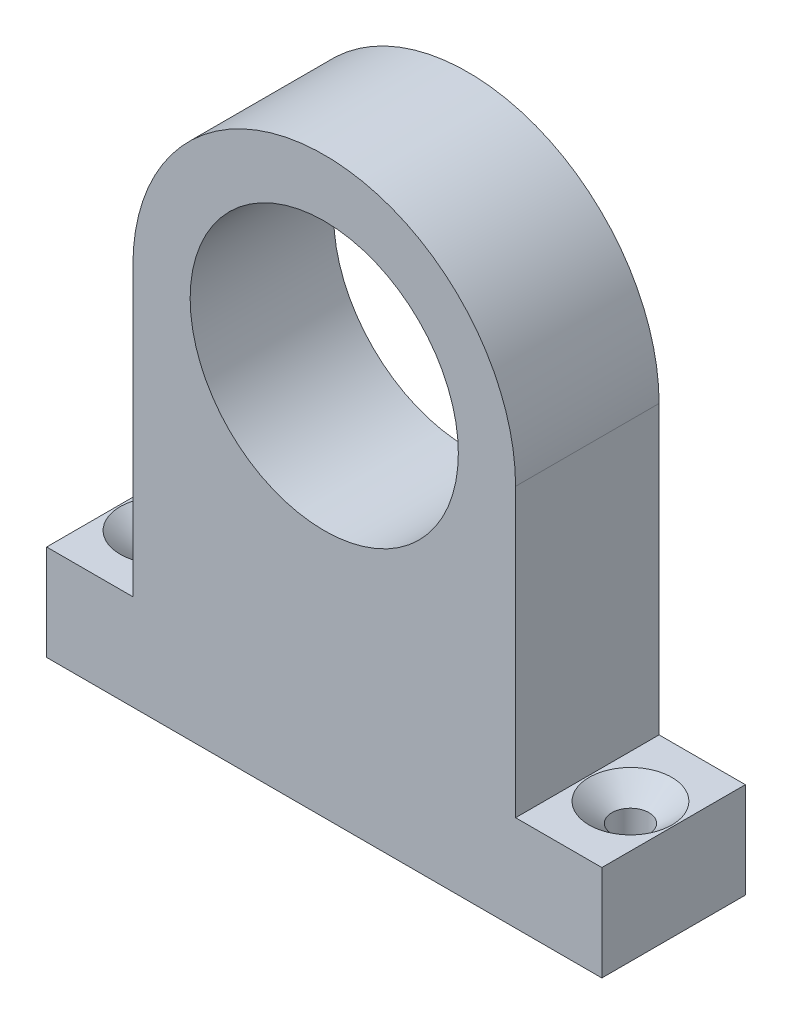
from build123d import *

# Parameters (mm, degrees)
SKETCH1_W                                         = 73.7
SKETCH1_H                                         = 19.05
BOSS_EXTRUDE2_DEPTH                               = 76.2
SKETCH2_R                                         = 17.8
CUT_EXTRUDE1_DEPTH                                = 104.891229177
CSK_FOR_8_FLAT_HEAD_MACHINE_SCREW_100_D           = 4.9149
CSK_FOR_8_FLAT_HEAD_MACHINE_SCREW_100_CSINK_D     = 10.9728
CSK_FOR_8_FLAT_HEAD_MACHINE_SCREW_100_CSINK_ANGLE = 100


with BuildPart() as part:
    # Sketch1 → Boss-Extrude2 (new body)
    with BuildSketch(Plane(origin=(0, 19.05, 0), x_dir=(1, 0, 0), z_dir=(0, 1, 0))):
        with Locations((0, -87.9856)):
            Rectangle(SKETCH1_W, SKETCH1_H)
    extrude(amount=BOSS_EXTRUDE2_DEPTH)

    # Sketch2 → Cut-Extrude1 (cut, through all)
    with BuildSketch(Plane.XY.offset(97.5106)):
        with BuildLine():
            Line((-36.85, 95.25), (-36.85, 31.75))
            Line((-36.85, 31.75), (-25.4, 31.75))
            Line((-25.4, 31.75), (-25.4, 69.85))
            ThreePointArc((-25.4, 69.85), (-17.960512267, 87.810512217), (-7.1e-08, 95.25))
            Line((-7.1e-08, 95.25), (-36.85, 95.25))
        make_face()
        with BuildLine():
            Line((25.4, 69.85), (25.4, 31.75))
            Line((25.4, 31.75), (36.85, 31.75))
            Line((36.85, 31.75), (36.85, 95.25))
            Line((36.85, 95.25), (-7.1e-08, 95.25))
            ThreePointArc((-7.1e-08, 95.25), (17.960512217, 87.810512267), (25.4, 69.85))
        make_face()
        with Locations((0, 69.85)):
            Circle(SKETCH2_R)
    extrude(amount=-CUT_EXTRUDE1_DEPTH, mode=Mode.SUBTRACT)

    # CSK for #8 Flat Head Machine Screw (100)1 (through all)
    with Locations(Plane(origin=(0, 31.75, 0), x_dir=(1, 0, 0), z_dir=(0, 1, 0))):
        with Locations((-31.125, -87.9856), (31.125, -87.9856)):
            CounterSinkHole(CSK_FOR_8_FLAT_HEAD_MACHINE_SCREW_100_D / 2, CSK_FOR_8_FLAT_HEAD_MACHINE_SCREW_100_CSINK_D / 2, counter_sink_angle=CSK_FOR_8_FLAT_HEAD_MACHINE_SCREW_100_CSINK_ANGLE)


solid = part.part
